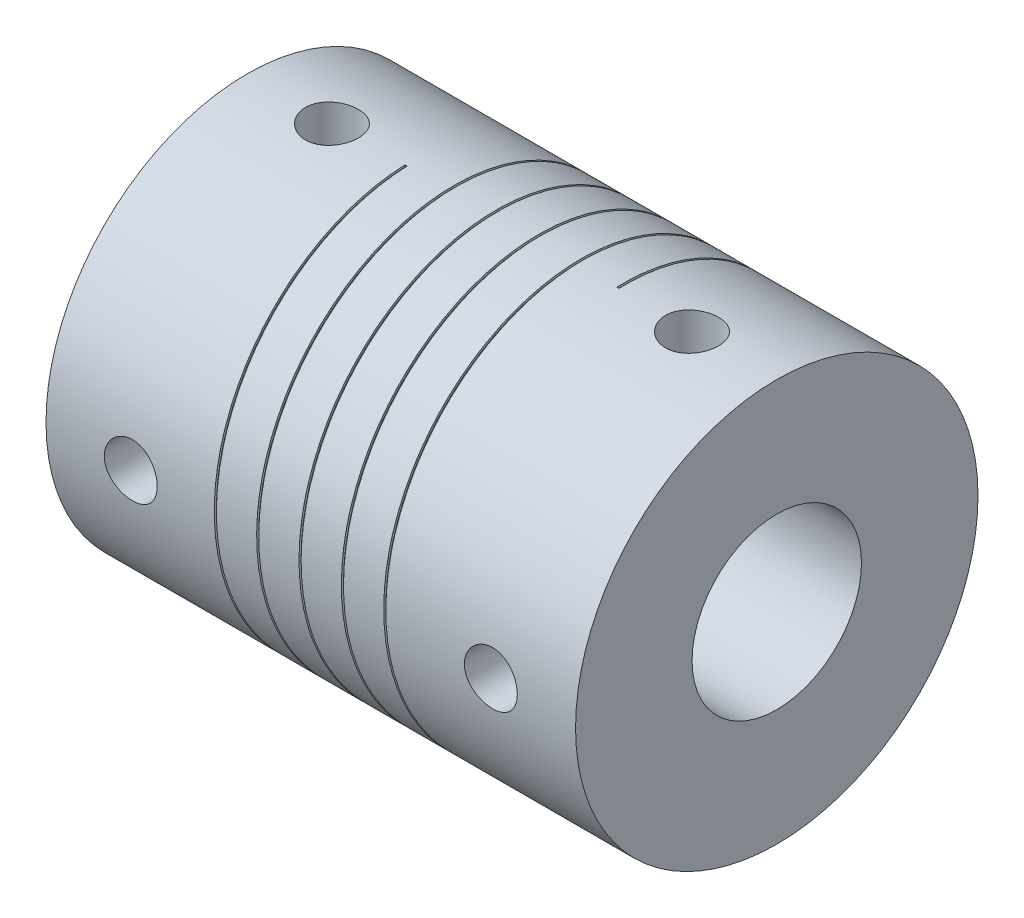
from build123d import *

# Parameters (mm, degrees)
SKETCH1_R                  = 9.5
BOSS_EXTRUDE1_DEPTH        = 25
SKETCH2_R                  = 4
CUT_EXTRUDE1_DEPTH         = 18
SKETCH3_R                  = 2.5
CUT_EXTRUDE2_DEPTH         = 7
CUT_SWEEP1_PITCH           = 2
SKETCH7_W                  = 1.25
SKETCH7_H                  = 9.5
M3_TAPPED_HOLE1_AT_2_COUNT = 2
M3_TAPPED_HOLE1_AT_2_PITCH = 17
SKETCH9_W                  = 1.25
SKETCH9_H                  = 9.5
M3_TAPPED_HOLE2_AT_2_COUNT = 2
M3_TAPPED_HOLE2_AT_2_PITCH = 17


with BuildPart() as part:
    # Sketch1 → Boss-Extrude1 (new body)
    with BuildSketch(Plane(origin=(0, 0, 0), x_dir=(0, 0, -1), z_dir=(1, 0, 0))):
        Circle(SKETCH1_R)
    extrude(amount=BOSS_EXTRUDE1_DEPTH)

    # Sketch2 → Cut-Extrude1 (cut)
    with BuildSketch(Plane(origin=(25, 0, 0), x_dir=(0, 0, -1), z_dir=(1, 0, 0))):
        Circle(SKETCH2_R)
    extrude(amount=-CUT_EXTRUDE1_DEPTH, mode=Mode.SUBTRACT)

    # Sketch3 → Cut-Extrude2 (cut)
    with BuildSketch(Plane.ZY):
        Circle(SKETCH3_R)
    extrude(amount=-CUT_EXTRUDE2_DEPTH, mode=Mode.SUBTRACT)

    # Cut-Sweep1: the profile of Sketch4 profile screwed along a right-hand helix of 5 turns, 10 arcs to a turn; built about Z, then put on its axis
    cut_sweep1_z = Axis((0, 0, 0), (0, 0, 1))
    cut_sweep1_corners = [(9.5003, 0, 0.45), (9.5003, 0, 0.55), (9.4, 0, 0.55), (9.4, 0, 0.45)]
    with BuildLine(mode=Mode.PRIVATE) as cut_sweep1_profile:
        Line(cut_sweep1_corners[0], cut_sweep1_corners[1])
        Line(cut_sweep1_corners[1], cut_sweep1_corners[2])
        Line(cut_sweep1_corners[2], cut_sweep1_corners[3])
        Line(cut_sweep1_corners[3], cut_sweep1_corners[0])
    cut_sweep1_cap = Face(cut_sweep1_profile.wire())
    cut_sweep1_turn_angles = [0, 18, 36, 54, 72, 90, 108, 126, 144, 162, 180, 198, 216, 234, 252, 270, 288, 306, 324, 342, 360]
    cut_sweep1_turn_weights = [1, 0.9510565162951535, 1, 0.9510565162951535, 1, 0.9510565162951535, 1, 0.9510565162951535, 1, 0.9510565162951535, 1, 0.9510565162951535, 1, 0.9510565162951535, 1, 0.9510565162951535, 1, 0.9510565162951535, 1, 0.9510565162951535, 1]
    cut_sweep1_turn_rails = [Edge.make_bspline([Vector(p[0], p[1], 0).rotate(cut_sweep1_z, cut_sweep1_turn_angles[k]) / cut_sweep1_turn_weights[k] + Vector(0, 0, p[2] + CUT_SWEEP1_PITCH * cut_sweep1_turn_angles[k] / 360) for k in range(21)], [0, 0, 0, 1, 1, 2, 2, 3, 3, 4, 4, 5, 5, 6, 6, 7, 7, 8, 8, 9, 9, 10, 10, 10], 2, cut_sweep1_turn_weights) for p in cut_sweep1_corners]
    cut_sweep1_turn_sides = [Face.make_surface_from_curves(cut_sweep1_turn_rails[p[0]], cut_sweep1_turn_rails[p[1]]) for p in [(0, 1), (1, 2), (2, 3), (3, 0)]]
    cut_sweep1 = Plane(origin=(7, 0, 0), x_dir=(0, 1, 0), z_dir=(1, 0, 0)) * Solid(Shell([*[p.moved(Location((0, 0, CUT_SWEEP1_PITCH * i))) for i in range(5) for p in cut_sweep1_turn_sides], cut_sweep1_cap, cut_sweep1_cap.rotate(cut_sweep1_z, 1800).moved(Location((0, 0, CUT_SWEEP1_PITCH * 1800 / 360)))]))
    add(cut_sweep1, mode=Mode.SUBTRACT)

    # Sketch7 → M3 Tapped Hole1 (revolve, cut)
    with BuildSketch(Plane(origin=(4, 0, 0), x_dir=(0, 0, -1), z_dir=(1, 0, 0))):
        with Locations((0.625, 4.75)):
            Rectangle(SKETCH7_W, SKETCH7_H)
    m3_tapped_hole1 = revolve(axis=Axis((4, -6.35, 0), (0, 1, 0)), mode=Mode.SUBTRACT)

    # M3 Tapped Hole1 at 2: M3 Tapped Hole1 ×2
    with Locations(*[(i * M3_TAPPED_HOLE1_AT_2_PITCH, 0, 0) for i in range(1, M3_TAPPED_HOLE1_AT_2_COUNT)]):
        add(m3_tapped_hole1, mode=Mode.SUBTRACT)

    # Sketch9 → M3 Tapped Hole2 (revolve, cut)
    with BuildSketch(Plane.YZ.offset(4)):
        with Locations((0.625, 4.75)):
            Rectangle(SKETCH9_W, SKETCH9_H)
    m3_tapped_hole2 = revolve(axis=Axis((4, 0, -6.35), (0, 0, 1)), mode=Mode.SUBTRACT)

    # M3 Tapped Hole2 at 2: M3 Tapped Hole2 ×2
    with Locations(*[(i * M3_TAPPED_HOLE2_AT_2_PITCH, 0, 0) for i in range(1, M3_TAPPED_HOLE2_AT_2_COUNT)]):
        add(m3_tapped_hole2, mode=Mode.SUBTRACT)


solid = part.part
